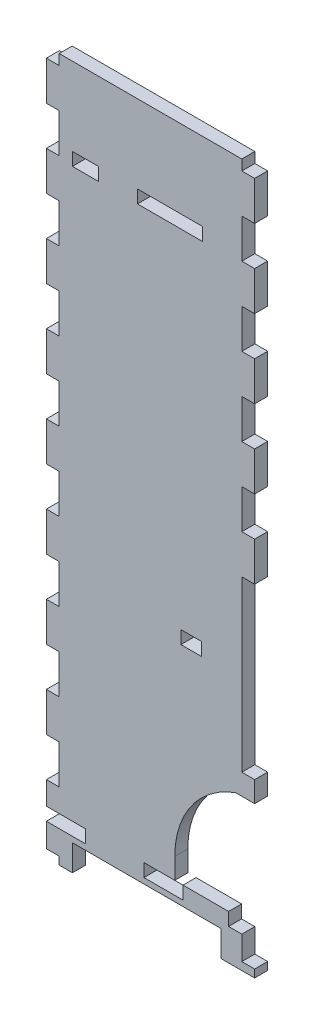
from build123d import *

# Parameters (mm, degrees)
BOSS_EXTRU_1_DEPTH      = 5
ESQUISSE2_W             = 8
ESQUISSE2_H             = 5
ESQUISSE2_W_2           = 15
ESQUISSE2_W_3           = 4.92
ESQUISSE2_H_2           = 65
ESQUISSE2_H_3           = 3
ESQUISSE2_H_4           = 15
ESQUISSE2_W_4           = 10
ESQUISSE2_W_5           = 25
ENL_V_MAT_EXTRU_1_DEPTH = 5
ESQUISSE3_W             = 7.280585373
ESQUISSE3_H             = 3.947256303
BOSS_EXTRU_2_DEPTH      = 5
ESQUISSE4_W             = 57
ESQUISSE4_H             = 10
ENL_V_MAT_EXTRU_2_DEPTH = 5


with BuildPart() as part:
    # Esquisse1 → Boss.-Extru.1 (new body)
    with BuildSketch(Plane.XY):
        with BuildLine():
            Line((0, 0), (80, 0))
            Line((80, 0), (80, 17.15))
            Line((80, 17.15), (49.330858803, 17.15))
            Line((49.330858803, 17.15), (49.330858803, 25.109342079))
            add(Edge.make_bspline(
                [(80, 59.779072791), (49.330858803, 55.600211761), (49.330858803, 25.109342079)],
                knots=[1.708281914, 1.708281914, 1.708281914, 3.141592654, 3.141592654, 3.141592654], degree=2, weights=[1, 0.754006918, 1]))
            Line((80, 59.779072791), (80, 270))
            Line((80, 270), (0, 270))
            Line((0, 270), (0, 0))
        make_face()
    extrude(amount=BOSS_EXTRU_1_DEPTH)

    # Esquisse2 → Enlèv. mat.-Extru.1 (cut)
    with BuildSketch(Plane.XY.offset(5)):
        with Locations((55.679721659, 99.250434868)):
            Rectangle(ESQUISSE2_W, ESQUISSE2_H)
        Polygon((75.08, 12.15), (70, 12.15), (70, 17.15), (80, 17.15), (80, 3), (75.08, 3), align=None)
        with Locations((45, 14.65)):
            Rectangle(ESQUISSE2_W_2, ESQUISSE2_H)
        with Locations((7.5, 14.65)):
            Rectangle(ESQUISSE2_W_2, ESQUISSE2_H)
        with Locations((77.54, 98.5)):
            Rectangle(ESQUISSE2_W_3, ESQUISSE2_H_2)
        with Locations((2.46, 1.5)):
            Rectangle(ESQUISSE2_W_3, ESQUISSE2_H_3)
        with Locations((77.54, 183.5)):
            Rectangle(ESQUISSE2_W_3, ESQUISSE2_H_4)
        with Locations((77.54, 153.5)):
            Rectangle(ESQUISSE2_W_3, ESQUISSE2_H_4)
        with Locations((77.54, 213.5)):
            Rectangle(ESQUISSE2_W_3, ESQUISSE2_H_4)
        with Locations((77.54, 243.5)):
            Rectangle(ESQUISSE2_W_3, ESQUISSE2_H_4)
        with Locations((77.54, 273.5)):
            Rectangle(ESQUISSE2_W_3, ESQUISSE2_H_4)
        with Locations((2.46, 273.5)):
            Rectangle(ESQUISSE2_W_3, ESQUISSE2_H_4)
        with Locations((2.46, 243.5)):
            Rectangle(ESQUISSE2_W_3, ESQUISSE2_H_4)
        with Locations((2.46, 213.5)):
            Rectangle(ESQUISSE2_W_3, ESQUISSE2_H_4)
        with Locations((2.46, 183.5)):
            Rectangle(ESQUISSE2_W_3, ESQUISSE2_H_4)
        with Locations((2.46, 153.5)):
            Rectangle(ESQUISSE2_W_3, ESQUISSE2_H_4)
        with Locations((2.46, 123.5)):
            Rectangle(ESQUISSE2_W_3, ESQUISSE2_H_4)
        with Locations((2.46, 93.5)):
            Rectangle(ESQUISSE2_W_3, ESQUISSE2_H_4)
        with Locations((2.46, 63.5)):
            Rectangle(ESQUISSE2_W_3, ESQUISSE2_H_4)
        with Locations((2.46, 33.5)):
            Rectangle(ESQUISSE2_W_3, ESQUISSE2_H_4)
        with Locations((15, 237.5)):
            Rectangle(ESQUISSE2_W_4, ESQUISSE2_H)
        with Locations((47.5, 237.5)):
            Rectangle(ESQUISSE2_W_5, ESQUISSE2_H)
    extrude(amount=-ENL_V_MAT_EXTRU_1_DEPTH, mode=Mode.SUBTRACT)

    # Esquisse3 → Boss.-Extru.2 (add)
    with BuildSketch(Plane(origin=(0, 0, 0), x_dir=(-1, 0, 0), z_dir=(0, 0, -1))):
        with Locations((-76.359707313, 59.973628152)):
            Rectangle(ESQUISSE3_W, ESQUISSE3_H)
    extrude(amount=-BOSS_EXTRU_2_DEPTH)

    # Esquisse4 → Enlèv. mat.-Extru.2 (cut)
    with BuildSketch(Plane.XY.offset(5)):
        with Locations((38.5, 5)):
            Rectangle(ESQUISSE4_W, ESQUISSE4_H)
    extrude(amount=-ENL_V_MAT_EXTRU_2_DEPTH, mode=Mode.SUBTRACT)


solid = part.part
